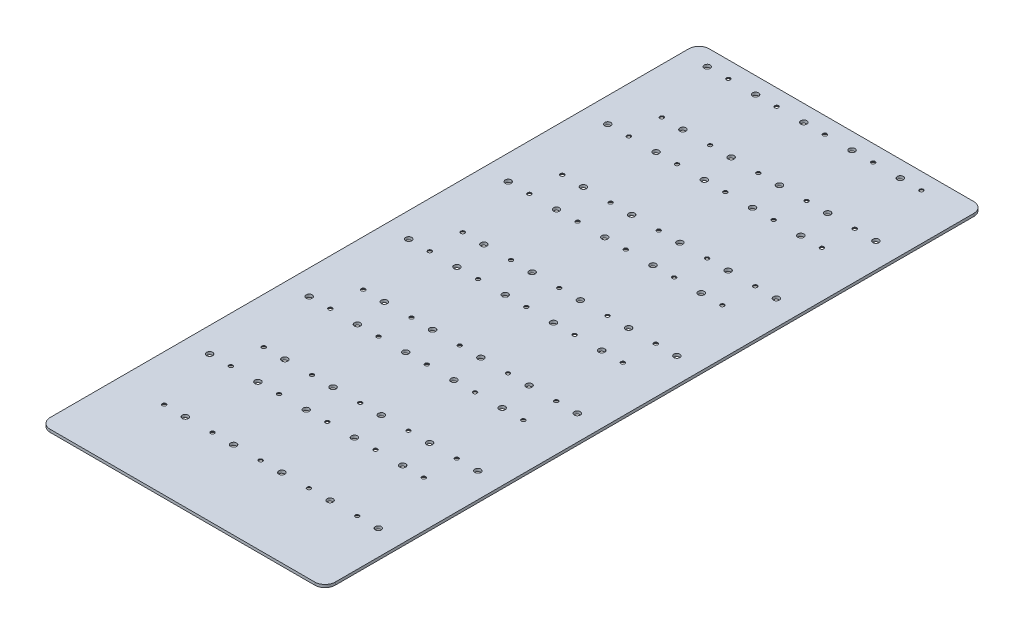
from build123d import *

# Parameters (mm, degrees)
SKETCH1_W                  = 236.3
SKETCH1_H                  = 546.3
BOSS_EXTRUDE1_DEPTH        = 2.286
SKETCH2_R                  = 2.5
SKETCH2_R_2                = 1.6
CUT_EXTRUDE1_DEPTH         = 298.616482736
CHAMFER1_SIZE              = 1.8
LPATTERN3_COUNT            = 6
LPATTERN3_PITCH            = 82.5
LPATTERN3_COUNT_DIR2       = 5
LPATTERN3_PITCH_DIR2       = 40
CHAMFER1_OF_LPATTERN3_SIZE = 1.8
FILLET1_R                  = 8.5


with BuildPart() as part:
    # Sketch1 → Boss-Extrude1 (new body)
    with BuildSketch(Plane(origin=(0, 0, 0), x_dir=(1, 0, 0), z_dir=(0, 1, 0))):
        Rectangle(SKETCH1_W, SKETCH1_H)
    extrude(amount=BOSS_EXTRUDE1_DEPTH)

    # Sketch2 → Cut-Extrude1 (cut, symmetric)
    with BuildSketch(Plane(origin=(0, 2.286, 0), x_dir=(1, 0, 0), z_dir=(0, 1, 0))):
        with Locations((-97.61, 259.5)):
            Circle(SKETCH2_R)
        with Locations((-80.11, 259.5)):
            Circle(SKETCH2_R_2)
        with Locations((-62.61, 204.3)):
            Circle(SKETCH2_R)
        with Locations((-80.11, 204.3)):
            Circle(SKETCH2_R_2)
    cut_extrude1 = extrude(amount=CUT_EXTRUDE1_DEPTH, both=True, mode=Mode.SUBTRACT)

    # Chamfer1
    chamfer1_edges = [part.edges().sort_by_distance(p)[0] for p in [
        (-81.71, 0, -259.5),
        (-81.71, 0, -204.3),
    ]]
    chamfer(chamfer1_edges, length=CHAMFER1_SIZE)

    # LPattern3: Cut-Extrude1 6 × 5
    with Locations(*[(j * LPATTERN3_PITCH_DIR2, 0, i * LPATTERN3_PITCH) for i in range(LPATTERN3_COUNT) for j in range(LPATTERN3_COUNT_DIR2) if (i, j) != (0, 0)]):
        add(cut_extrude1, mode=Mode.SUBTRACT)

    # Chamfer1 of LPattern3
    chamfer1_of_lpattern3_edges = [part.edges().sort_by_distance(p)[0] for p in [
        (-41.71, 0, -259.5),
        (-41.71, 0, -204.3),
        (-1.71, 0, -259.5),
        (-1.71, 0, -204.3),
        (38.29, 0, -259.5),
        (38.29, 0, -204.3),
        (78.29, 0, -259.5),
        (78.29, 0, -204.3),
        (-81.71, 0, -177),
        (-81.71, 0, -121.8),
        (-41.71, 0, -177),
        (-41.71, 0, -121.8),
        (-1.71, 0, -177),
        (-1.71, 0, -121.8),
        (38.29, 0, -177),
        (38.29, 0, -121.8),
        (78.29, 0, -177),
        (78.29, 0, -121.8),
        (-81.71, 0, -94.5),
        (-81.71, 0, -39.3),
        (-41.71, 0, -94.5),
        (-41.71, 0, -39.3),
        (-1.71, 0, -94.5),
        (-1.71, 0, -39.3),
        (38.29, 0, -94.5),
        (38.29, 0, -39.3),
        (78.29, 0, -94.5),
        (78.29, 0, -39.3),
        (-81.71, 0, -12),
        (-81.71, 0, 43.2),
        (-41.71, 0, -12),
        (-41.71, 0, 43.2),
        (-1.71, 0, -12),
        (-1.71, 0, 43.2),
        (38.29, 0, -12),
        (38.29, 0, 43.2),
        (78.29, 0, -12),
        (78.29, 0, 43.2),
        (-81.71, 0, 70.5),
        (-81.71, 0, 125.7),
        (-41.71, 0, 70.5),
        (-41.71, 0, 125.7),
        (-1.71, 0, 70.5),
        (-1.71, 0, 125.7),
        (38.29, 0, 70.5),
        (38.29, 0, 125.7),
        (78.29, 0, 70.5),
        (78.29, 0, 125.7),
        (-81.71, 0, 153),
        (-81.71, 0, 208.2),
        (-41.71, 0, 153),
        (-41.71, 0, 208.2),
        (-1.71, 0, 153),
        (-1.71, 0, 208.2),
        (38.29, 0, 153),
        (38.29, 0, 208.2),
        (78.29, 0, 153),
        (78.29, 0, 208.2),
    ]]
    chamfer(chamfer1_of_lpattern3_edges, length=CHAMFER1_OF_LPATTERN3_SIZE)

    # Fillet1
    fillet1_edges = [part.edges().sort_by_distance(p)[0] for p in [
        (118.15, 1.143, -273.15),
        (-118.15, 1.143, 273.15),
        (118.15, 1.143, 273.15),
        (-118.15, 1.143, -273.15),
    ]]
    fillet(fillet1_edges, radius=FILLET1_R)


solid = part.part
